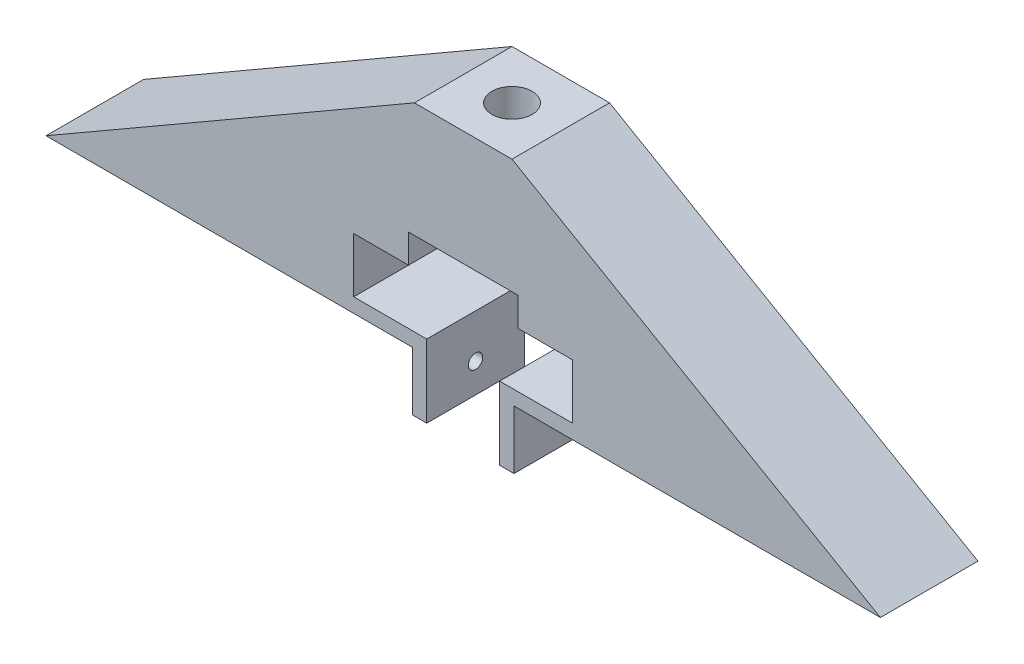
from build123d import *

# Parameters (mm, degrees)
BOSS_EXTRUDE1_DEPTH = 34
SKETCH2_R           = 7
CUT_EXTRUDE1_DEPTH  = 35
SKETCH3_R           = 2.5
CUT_EXTRUDE2_DEPTH  = 183.292266868


with BuildPart() as part:
    # Sketch1 → Boss-Extrude1 (new body)
    with BuildSketch(Plane.XY):
        Polygon((-145.344964841, 0), (-17.7, 0), (-17.7, -20.4), (-12.7, -20.4), (-12.7, 5), (-38.15, 5), (-38.15, 24.1), (-19.05, 24.1), (-19.05, 34.1), (19.05, 34.1), (19.05, 24.1), (38.15, 24.1), (38.15, 5), (12.7, 5), (12.7, -20.4), (17.7, -20.4), (17.7, 0), (145.344964841, 0), (17, 74.1), (-17, 74.1), align=None)
    extrude(amount=BOSS_EXTRUDE1_DEPTH)

    # Sketch2 → Cut-Extrude1 (cut)
    with BuildSketch(Plane(origin=(0, 74.1, 0), x_dir=(1, 0, 0), z_dir=(0, 1, 0))):
        with Locations((0, -17)):
            Circle(SKETCH2_R)
    extrude(amount=-CUT_EXTRUDE1_DEPTH, mode=Mode.SUBTRACT)

    # Sketch3 → Cut-Extrude2 (cut, through all)
    with BuildSketch(Plane(origin=(17.7, 0, 0), x_dir=(0, 0, -1), z_dir=(1, 0, 0))):
        with Locations((-17, -10.2)):
            Circle(SKETCH3_R)
    extrude(amount=-CUT_EXTRUDE2_DEPTH, mode=Mode.SUBTRACT)


solid = part.part
